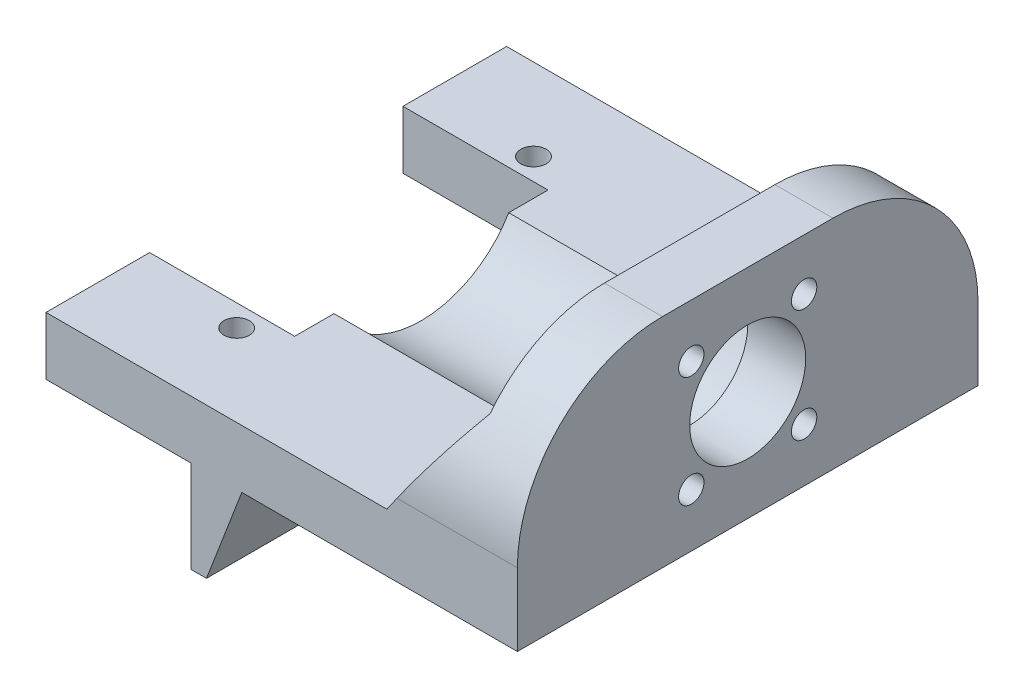
from build123d import *
from OCP.BRepFilletAPI import BRepFilletAPI_MakeChamfer

# Parameters (mm, degrees)
BOSS_EXTRUDE1_DEPTH = 30
SKETCH2_W           = 57
SKETCH2_H           = 22
CUT_EXTRUDE1_DEPTH  = 84.417744515
SKETCH4_R           = 8
SKETCH4_R_2         = 1.75
CUT_EXTRUDE2_DEPTH  = 79.315898929
SKETCH5_R           = 14
CUT_EXTRUDE3_DEPTH  = 37
SKETCH6_R           = 1.75
CUT_EXTRUDE4_DEPTH  = 60.307503952
CHAMFER1_SIZE       = 10
CHAMFER1_SIZE2      = 14.281480067
FILLET3_R           = 20
SKETCH11_W          = 2
SKETCH11_H          = 14.29
BOSS_EXTRUDE3_DEPTH = 12.7
CHAMFER2_SIZE       = 5
CHAMFER2_SIZE_2     = 13.025445323


with BuildPart() as part:
    # Sketch1 → Boss-Extrude1 (new body)
    with BuildSketch(Plane(origin=(0, 0, 0), x_dir=(1, 0, 0), z_dir=(0, 1, 0))):
        Polygon((0, 0), (0, -17.465), (-20, -17.465), (-20, -31.755), (45, -31.755), (45, 0), align=None)
        Polygon((0, 17.465), (0, 0), (45, 0), (45, 31.755), (-20, 31.755), (-20, 17.465), align=None)
    extrude(amount=BOSS_EXTRUDE1_DEPTH)

    # Sketch2 → Cut-Extrude1 (cut, through all)
    with BuildSketch(Plane.XY.offset(31.755)):
        with Locations((8.5, 19)):
            Rectangle(SKETCH2_W, SKETCH2_H)
    extrude(amount=-CUT_EXTRUDE1_DEPTH, mode=Mode.SUBTRACT)

    # Sketch4 → Cut-Extrude2 (cut, through all)
    with BuildSketch(Plane(origin=(45, 0, 0), x_dir=(0, 0, -1), z_dir=(1, 0, 0))):
        with Locations((0, 15.135)):
            Circle(SKETCH4_R)
        with Locations((-7.778174593, 22.683263808)):
            Circle(SKETCH4_R_2)
        with Locations((7.778174593, 22.913174593)):
            Circle(SKETCH4_R_2)
        with Locations((7.778174593, 7.356825407)):
            Circle(SKETCH4_R_2)
        with Locations((-7.778174593, 7.356825407)):
            Circle(SKETCH4_R_2)
    extrude(amount=-CUT_EXTRUDE2_DEPTH, mode=Mode.SUBTRACT)

    # Sketch5 → Cut-Extrude3 (cut)
    with BuildSketch(Plane.ZY):
        with Locations((0, 15.135)):
            Circle(SKETCH5_R)
    extrude(amount=-CUT_EXTRUDE3_DEPTH, mode=Mode.SUBTRACT)

    # Sketch6 → Cut-Extrude4 (cut, through all)
    with BuildSketch(Plane(origin=(0, 8, 0), x_dir=(1, 0, 0), z_dir=(0, 1, 0))):
        with Locations(Location((-5, -20.465, 0), (0, 0, 270))):
            Circle(SKETCH6_R)
    cut_extrude4 = extrude(amount=-CUT_EXTRUDE4_DEPTH, mode=Mode.SUBTRACT)

    # Mirror1: Cut-Extrude4 across plane
    add(cut_extrude4.mirror(Plane.XY), mode=Mode.SUBTRACT)

    # Chamfer1: one chamfer whose edges measure the first distance from different faces: ONE call of the kernel's chamfer builder (chamfer() names one face for all edges)
    chamfer1_edges_1 = [part.edges().sort_by_distance(p)[0] for p in [
        (37, 8, -21.900202363),
    ]]
    chamfer1_side_1 = [part.faces().sort_by_distance(p)[0] for p in [
        (10.623596069, 8, -22.684210572),
    ]]
    chamfer1_edges_2 = [part.edges().sort_by_distance(p)[0] for p in [
        (37, 8, 21.900202363),
    ]]
    chamfer1_side_2 = [part.faces().sort_by_distance(p)[0] for p in [
        (10.623596069, 8, 22.684210572),
    ]]
    chamfer1 = BRepFilletAPI_MakeChamfer(part.part.solid().wrapped)
    for e in chamfer1_edges_1:
        chamfer1.Add(CHAMFER1_SIZE, CHAMFER1_SIZE2, e.wrapped, chamfer1_side_1[0].wrapped)  # the first distance lies on this face
    for e in chamfer1_edges_2:
        chamfer1.Add(CHAMFER1_SIZE, CHAMFER1_SIZE2, e.wrapped, chamfer1_side_2[0].wrapped)  # the first distance lies on this face
    add(Compound.cast(chamfer1.Shape()), mode=Mode.REPLACE)

    # Fillet3
    fillet3_edges = [part.edges().sort_by_distance(p)[0] for p in [
        (41, 30, -31.755),
        (41, 30, 31.755),
    ]]
    fillet(fillet3_edges, radius=FILLET3_R)

    # Sketch11 → Boss-Extrude3 (add)
    with BuildSketch(Plane.XZ):
        with Locations((1, 24.61)):
            Rectangle(SKETCH11_W, SKETCH11_H)
        with Locations((1, -24.61)):
            Rectangle(SKETCH11_W, SKETCH11_H)
        with Locations((1, 0)):
            Rectangle(SKETCH11_W, SKETCH11_H)
    extrude(amount=BOSS_EXTRUDE3_DEPTH)

    # Chamfer2
    # the kernel refuses this chamfer: 13.025445323, 5 mm, written as the material it adds along each edge
    with BuildSketch(Plane(origin=(2, 0, -16.317868448), x_dir=(0.9956314177255227, 0.0933706594057566, 0), z_dir=(0, 0, 1))) as chamfer2_piece_1_section:
        Polygon((CHAMFER2_SIZE * 0.995631417726, -CHAMFER2_SIZE * 0.0933706594058), (-CHAMFER2_SIZE_2 * 0.0933706594091, -CHAMFER2_SIZE_2 * 0.995631417761), (0, 0), align=None)
    chamfer2_piece_1 = extrude(amount=48.072868448, mode=Mode.PRIVATE)
    chamfer2_piece_1 = split(chamfer2_piece_1, bisect_by=Plane(origin=(3.561931583, -4.37126632, 7.145), z_dir=(0, 0, -1)), keep=Keep.TOP, mode=Mode.PRIVATE)
    chamfer2_piece_1 = split(chamfer2_piece_1, bisect_by=Plane(origin=(3.561931583, -4.37126632, -7.145), z_dir=(0, 0, 1)), keep=Keep.TOP, mode=Mode.PRIVATE)
    chamfer2_piece_1 = split(chamfer2_piece_1, bisect_by=Plane(origin=(3.561931583, -12.7, 0), z_dir=(0, 1, 0)), keep=Keep.TOP, mode=Mode.PRIVATE)
    add(chamfer2_piece_1)
    with BuildSketch(Plane(origin=(2, 0, 17.465), x_dir=(0.9956314177255227, 0.0933706594057566, 0), z_dir=(0, 0, 1))) as chamfer2_piece_2_section:
        Polygon((CHAMFER2_SIZE * 0.995631417726, -CHAMFER2_SIZE * 0.0933706594058), (-CHAMFER2_SIZE_2 * 0.0933706594091, -CHAMFER2_SIZE_2 * 0.995631417761), (0, 0), align=None)
    chamfer2_piece_2 = extrude(amount=14.29, mode=Mode.PRIVATE)
    chamfer2_piece_2 = split(chamfer2_piece_2, bisect_by=Plane(origin=(3.561931583, -12.7, 24.61), z_dir=(0, 1, 0)), keep=Keep.TOP, mode=Mode.PRIVATE)
    add(chamfer2_piece_2)
    with BuildSketch(Plane(origin=(2, 0, 40.927868448), x_dir=(0.9956314177255227, 0.0933706594057566, 0), z_dir=(0, 0, -1))) as chamfer2_piece_3_section:
        Polygon((CHAMFER2_SIZE * 0.995631417726, CHAMFER2_SIZE * 0.0933706594058), (-CHAMFER2_SIZE_2 * 0.0933706594091, CHAMFER2_SIZE_2 * 0.995631417761), (0, 0), align=None)
    chamfer2_piece_3 = extrude(amount=48.072868448, mode=Mode.PRIVATE)
    chamfer2_piece_3 = split(chamfer2_piece_3, bisect_by=Plane(origin=(3.561931583, -4.37126632, 31.755), z_dir=(0, 0, -1)), keep=Keep.TOP, mode=Mode.PRIVATE)
    chamfer2_piece_3 = split(chamfer2_piece_3, bisect_by=Plane(origin=(3.561931583, -12.7, 24.61), z_dir=(0, 1, 0)), keep=Keep.TOP, mode=Mode.PRIVATE)
    chamfer2_piece_3 = split(chamfer2_piece_3, bisect_by=Plane(origin=(3.561931583, -4.37126632, 17.465), z_dir=(0, 0, 1)), keep=Keep.TOP, mode=Mode.PRIVATE)
    add(chamfer2_piece_3)
    with BuildSketch(Plane(origin=(2, 0, 7.145), x_dir=(0.9956314177255227, 0.0933706594057566, 0), z_dir=(0, 0, -1))) as chamfer2_piece_4_section:
        Polygon((CHAMFER2_SIZE * 0.995631417726, CHAMFER2_SIZE * 0.0933706594058), (-CHAMFER2_SIZE_2 * 0.0933706594091, CHAMFER2_SIZE_2 * 0.995631417761), (0, 0), align=None)
    chamfer2_piece_4 = extrude(amount=14.29, mode=Mode.PRIVATE)
    chamfer2_piece_4 = split(chamfer2_piece_4, bisect_by=Plane(origin=(3.561931583, -12.7, 0), z_dir=(0, 1, 0)), keep=Keep.TOP, mode=Mode.PRIVATE)
    add(chamfer2_piece_4)
    with BuildSketch(Plane(origin=(2, 0, 7.145), x_dir=(0.9956314177255227, 0.0933706594057566, 0), z_dir=(0, 0, -1))) as chamfer2_piece_5_section:
        Polygon((CHAMFER2_SIZE * 0.995631417726, CHAMFER2_SIZE * 0.0933706594058), (-CHAMFER2_SIZE_2 * 0.0933706594091, CHAMFER2_SIZE_2 * 0.995631417761), (0, 0), align=None)
    chamfer2_piece_5 = extrude(amount=48.072868448, mode=Mode.PRIVATE)
    chamfer2_piece_5 = split(chamfer2_piece_5, bisect_by=Plane(origin=(3.561931583, -4.37126632, -31.755), z_dir=(0, 0, 1)), keep=Keep.TOP, mode=Mode.PRIVATE)
    chamfer2_piece_5 = split(chamfer2_piece_5, bisect_by=Plane(origin=(3.561931583, -12.7, -24.61), z_dir=(0, 1, 0)), keep=Keep.TOP, mode=Mode.PRIVATE)
    chamfer2_piece_5 = split(chamfer2_piece_5, bisect_by=Plane(origin=(3.561931583, -4.37126632, -17.465), z_dir=(0, 0, -1)), keep=Keep.TOP, mode=Mode.PRIVATE)
    add(chamfer2_piece_5)
    with BuildSketch(Plane(origin=(2, 0, 16.317868448), x_dir=(0.9956314177255227, 0.0933706594057566, 0), z_dir=(0, 0, -1))) as chamfer2_piece_6_section:
        Polygon((CHAMFER2_SIZE * 0.995631417726, CHAMFER2_SIZE * 0.0933706594058), (-CHAMFER2_SIZE_2 * 0.0933706594091, CHAMFER2_SIZE_2 * 0.995631417761), (0, 0), align=None)
    chamfer2_piece_6 = extrude(amount=48.072868448, mode=Mode.PRIVATE)
    chamfer2_piece_6 = split(chamfer2_piece_6, bisect_by=Plane(origin=(3.561931583, -4.37126632, 7.145), z_dir=(0, 0, -1)), keep=Keep.TOP, mode=Mode.PRIVATE)
    chamfer2_piece_6 = split(chamfer2_piece_6, bisect_by=Plane(origin=(3.561931583, -4.37126632, -7.145), z_dir=(0, 0, 1)), keep=Keep.TOP, mode=Mode.PRIVATE)
    chamfer2_piece_6 = split(chamfer2_piece_6, bisect_by=Plane(origin=(3.561931583, -12.7, 0), z_dir=(0, 1, 0)), keep=Keep.TOP, mode=Mode.PRIVATE)
    add(chamfer2_piece_6)
    with BuildSketch(Plane(origin=(2, 0, -17.465), x_dir=(0.9956314177255227, 0.0933706594057566, 0), z_dir=(0, 0, -1))) as chamfer2_piece_7_section:
        Polygon((CHAMFER2_SIZE * 0.995631417726, CHAMFER2_SIZE * 0.0933706594058), (-CHAMFER2_SIZE_2 * 0.0933706594091, CHAMFER2_SIZE_2 * 0.995631417761), (0, 0), align=None)
    chamfer2_piece_7 = extrude(amount=14.29, mode=Mode.PRIVATE)
    chamfer2_piece_7 = split(chamfer2_piece_7, bisect_by=Plane(origin=(3.561931583, -12.7, -24.61), z_dir=(0, 1, 0)), keep=Keep.TOP, mode=Mode.PRIVATE)
    add(chamfer2_piece_7)


solid = part.part
